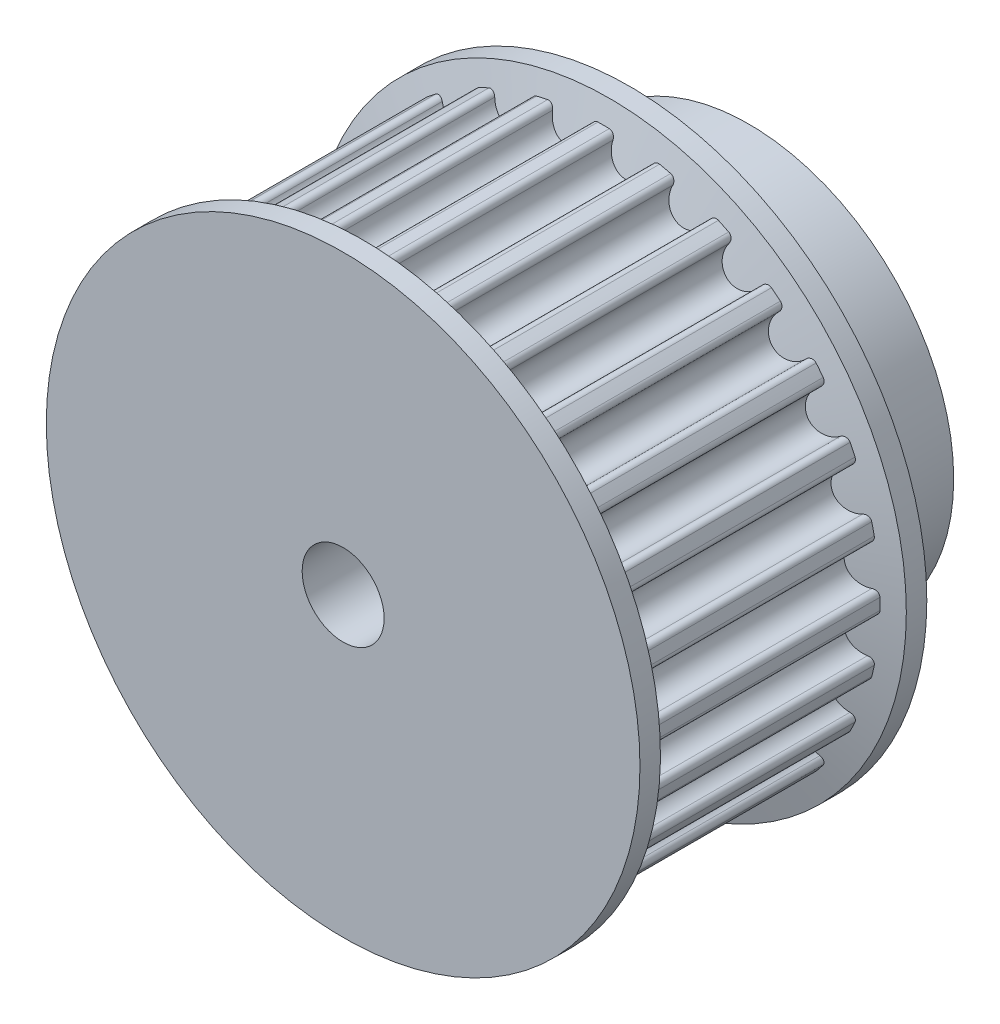
from build123d import *
from build123d.topology import SkipClean

# Parameters (mm, degrees)
SKETCH1_R               = 22.281691614
BOSS_EXTRUDE1_DEPTH     = 9.525
CUT_EXTRUDE1_DEPTH      = 33.919191779
CIRPATTERN1_COUNT       = 28
SKETCH4_R               = 22.999191614
SKETCH4_R_2             = 3.175
BOSS_EXTRUDE2_DEPTH     = 1.5875
CUT_EXTRUDE2_DEPTH      = 39.520540443
CUT_EXTRUDE2_DEPTH_BACK = 39.520540443
SKETCH3_R               = 3.175
SKETCH8_R               = 15.875
SKETCH8_R_2             = 3.175
BOSS_EXTRUDE3_DEPTH     = 9.2075
CUT_EXTRUDE3_DEPTH      = 6.35
CUT_EXTRUDE4_DEPTH      = 42.59694973
CUT_EXTRUDE4_DEPTH_BACK = 4.572
SKETCH10_3_R            = 2.54


with BuildPart() as part:
    # Sketch1 → Boss-Extrude1 (new, symmetric)
    with BuildSketch(Plane.XY):
        with Locations(Location((0, 0, 0), (0, 0, 180))):
            Circle(SKETCH1_R)
    extrude(amount=BOSS_EXTRUDE1_DEPTH, both=True)

    # Sketch2 → Cut-Extrude1 (cut, symmetric)
    with BuildSketch(Plane.XY):
        with BuildLine():
            Line((0, 21.411691614), (0, 22.281691614))
            ThreePointArc((0, 22.281691614), (2.494757928, 22.141589014), (4.958142828, 21.723043085))
            Line((4.958142828, 21.723043085), (4.764549616, 20.874855801))
            ThreePointArc((4.764549616, 20.874855801), (4.5493162, 20.922816729), (4.33360027, 20.968558522))
            ThreePointArc((4.33360027, 20.968558522), (3.989448509, 20.89211427), (3.818126536, 20.584002375))
            ThreePointArc((3.818126536, 20.584002375), (2.166702013, 19.230012239), (0.857973301, 20.917531543))
            ThreePointArc((0.857973301, 20.917531543), (0.759508074, 21.256041154), (0.440995363, 21.40714976))
            ThreePointArc((0.440995363, 21.40714976), (0.220509375, 21.41055612), (0, 21.411691614))
        make_face()
    cut_extrude1 = extrude(amount=CUT_EXTRUDE1_DEPTH, both=True, mode=Mode.SUBTRACT)

    # CirPattern1: Cut-Extrude1 ×28 about axis
    cirpattern1_axis = Axis((0, 0, 0), (0, 0, 1))
    for i in range(1, CIRPATTERN1_COUNT):
        add(cut_extrude1.rotate(cirpattern1_axis, i * 360 / CIRPATTERN1_COUNT), mode=Mode.SUBTRACT)

    # Sketch4 → Boss-Extrude2 (add)
    with BuildSketch(Plane.XY.offset(9.525)):
        Circle(SKETCH4_R)
        Circle(SKETCH4_R_2, mode=Mode.SUBTRACT)
    boss_extrude2 = extrude(amount=BOSS_EXTRUDE2_DEPTH)

    # Sketch3 → Cut-Extrude2 (cut, two sides: drawn at the far end of the back side and taken through both)
    with BuildSketch(Plane.XY.offset(11.1125).offset(-CUT_EXTRUDE2_DEPTH_BACK)):
        Circle(SKETCH3_R)
    extrude(amount=CUT_EXTRUDE2_DEPTH + CUT_EXTRUDE2_DEPTH_BACK, mode=Mode.SUBTRACT)

    # Sketch6 → Revolve1 (revolve)
    with BuildSketch(Plane(origin=(0, 0, 0), x_dir=(1, 0, 0), z_dir=(0, 1, 0)), mode=Mode.PRIVATE) as revolve1_sk:
        Polygon((22.999191614, -9.525), (18.542, -8.255), (18.542, -9.525), align=None)
    revolve1 = revolve(revolve1_sk.sketch.rotate(Axis((0, 0, -9.525), (0, 0, 1)), 358.819852246), axis=Axis((0, 0, -9.525), (0, 0, 1)))

    # Mirror1: Boss-Extrude2, Revolve1 across plane
    add(boss_extrude2.mirror(Plane.XY))
    add(revolve1.mirror(Plane.XY))

    # Sketch8 → Boss-Extrude3 (add)
    with SkipClean():  # the faces are left unmerged after this step: merging them gives an invalid solid
        with BuildSketch(Plane(origin=(0, 0, -11.1125), x_dir=(-1, 0, 0), z_dir=(0, 0, -1))):
            Circle(SKETCH8_R)
            Circle(SKETCH8_R_2, mode=Mode.SUBTRACT)
        extrude(amount=BOSS_EXTRUDE3_DEPTH)
    add(part.part.scale(1), mode=Mode.REPLACE)  # the faces are merged on a copy

    # Sketch10 → Cut-Extrude3 (cut)
    with BuildSketch(Plane.XZ.offset(5.08)):
        Polygon((5.719231767, -16.7005), (2.859615883, -11.7475), (-2.859615883, -11.7475), (-5.719231767, -16.7005), (-5.719231767, -24.8285), (5.719231767, -24.8285), align=None)
    extrude(amount=CUT_EXTRUDE3_DEPTH, mode=Mode.SUBTRACT)

    # Sketch10<3> → Cut-Extrude4 (cut, two sides: drawn at the far end of the back side and taken through both)
    with BuildSketch(Plane.XZ.offset(5.08).offset(-CUT_EXTRUDE4_DEPTH_BACK)):
        with Locations(Location((0, -16.7005, 0), (0, 0, 90))):
            Circle(SKETCH10_3_R)
    extrude(amount=CUT_EXTRUDE4_DEPTH + CUT_EXTRUDE4_DEPTH_BACK, mode=Mode.SUBTRACT)


solid = part.part
